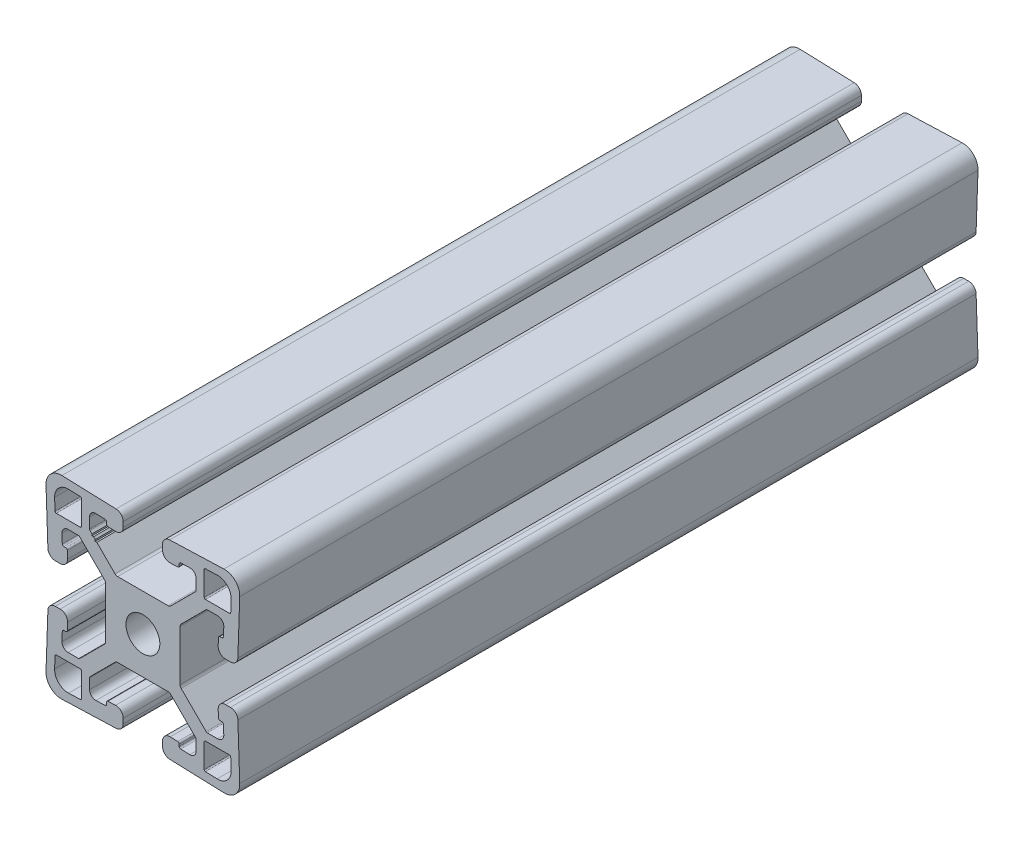
from build123d import *

# Parameters (mm, degrees)
BOSS_EXTRUDE1_DEPTH     = 76.2
CIRPATTERN1_COUNT       = 4
CUT_EXTRUDE1_DEPTH      = 82.280009843
CUT_EXTRUDE1_DEPTH_BACK = 82.280009843


with BuildPart() as part:
    # Sketch3 → Boss-Extrude1 (new, symmetric)
    with BuildSketch(Plane.XY):
        with BuildLine():
            Line((-7.681, 0), (-7.681, 5.210107796))
            ThreePointArc((-7.681, 5.210107796), (-7.739003796, 5.501712572), (-7.904184633, 5.748923164))
            Line((-7.904184633, 5.748923164), (-13.062267872, 10.907006403))
            ThreePointArc((-13.062267872, 10.907006403), (-13.165272285, 10.975831752), (-13.286774275, 11))
            Line((-13.286774275, 11), (-15.433540431, 11))
            ThreePointArc((-15.433540431, 11), (-16.347101978, 10.61221613), (-16.702766782, 9.685677639))
            Line((-16.702766782, 9.685677639), (-16.637141638, 7.80641941))
            ThreePointArc((-16.637141638, 7.80641941), (-16.540389083, 7.589109613), (-16.319835051, 7.5))
            Line((-16.319835051, 7.5), (-15.916428126, 7.5))
            ThreePointArc((-15.916428126, 7.5), (-15.695874093, 7.410890387), (-15.599121538, 7.19358059))
            Line((-15.599121538, 7.19358059), (-15.544946893, 5.642221732))
            ThreePointArc((-15.544946893, 5.642221732), (-15.972024709, 4.529645985), (-17.069017904, 4.064))
            Line((-17.069017904, 4.064), (-18.083635982, 4.064))
            ThreePointArc((-18.083635982, 4.064), (-19.142989997, 4.492006804), (-19.607706993, 5.535778268))
            Line((-19.607706993, 5.535778268), (-19.998065876, 16.714194098))
            ThreePointArc((-19.998065876, 16.714194098), (-19.07006403, 19.07006403), (-16.714194098, 19.998065876))
            Line((-16.714194098, 19.998065876), (-5.535778268, 19.607706993))
            ThreePointArc((-5.535778268, 19.607706993), (-4.492006804, 19.142989997), (-4.064, 18.083635982))
            Line((-4.064, 18.083635982), (-4.064, 17.069017904))
            ThreePointArc((-4.064, 17.069017904), (-4.529645985, 15.972024709), (-5.642221732, 15.544946893))
            Line((-5.642221732, 15.544946893), (-7.19358059, 15.599121538))
            ThreePointArc((-7.19358059, 15.599121538), (-7.410890387, 15.695874093), (-7.5, 15.916428126))
            Line((-7.5, 15.916428126), (-7.5, 16.319835051))
            ThreePointArc((-7.5, 16.319835051), (-7.589109613, 16.540389083), (-7.80641941, 16.637141638))
            Line((-7.80641941, 16.637141638), (-9.685677639, 16.702766782))
            ThreePointArc((-9.685677639, 16.702766782), (-10.61221613, 16.347101978), (-11, 15.433540431))
            Line((-11, 15.433540431), (-11, 13.286774275))
            ThreePointArc((-11, 13.286774275), (-10.975831752, 13.165272285), (-10.907006403, 13.062267872))
            Line((-10.907006403, 13.062267872), (-5.748923164, 7.904184633))
            ThreePointArc((-5.748923164, 7.904184633), (-5.501712572, 7.739003796), (-5.210107796, 7.681))
            Line((-5.210107796, 7.681), (0, 7.681))
            Line((0, 7.681), (0, 3.5))
            ThreePointArc((0, 3.5), (-2.474873734, 2.474873734), (-3.5, 0))
            Line((-3.5, 0), (-7.681, 0))
        make_face()
        with BuildLine():
            Line((-18.220706879, 15.330899714), (-18.136032248, 12.906135528))
            ThreePointArc((-18.136032248, 12.906135528), (-18.058630204, 12.732287691), (-17.882186978, 12.661))
            Line((-17.882186978, 12.661), (-12.915, 12.661))
            ThreePointArc((-12.915, 12.661), (-12.735394878, 12.735394878), (-12.661, 12.915))
            Line((-12.661, 12.915), (-12.661, 17.882186978))
            ThreePointArc((-12.661, 17.882186978), (-12.732287691, 18.058630204), (-12.906135528, 18.136032248))
            Line((-12.906135528, 18.136032248), (-15.330899714, 18.220706879))
            ThreePointArc((-15.330899714, 18.220706879), (-17.404065255, 17.404065255), (-18.220706879, 15.330899714))
        make_face(mode=Mode.SUBTRACT)
    boss_extrude1 = extrude(amount=BOSS_EXTRUDE1_DEPTH, both=True)

    # CirPattern1: Boss-Extrude1 ×4 about axis
    cirpattern1_axis = Axis((0, 0, 76.2), (0, 0, -1))
    for i in range(1, CIRPATTERN1_COUNT):
        add(boss_extrude1.rotate(cirpattern1_axis, i * 360 / CIRPATTERN1_COUNT))

    # Sketch4 → Cut-Extrude1 (cut, two sides: drawn at the far end of the back side and taken through both)
    with BuildSketch(Plane.XY.offset(-CUT_EXTRUDE1_DEPTH_BACK)):
        Polygon((-10.505738531, 12.661), (-9.505738531, 12.661), (-9.505738531, 11.661), (-9.839071864, 11.661), (-9.839071864, 11.994333333), (-10.172405198, 12.327666667), (-10.505738531, 12.327666667), align=None)
    extrude(amount=CUT_EXTRUDE1_DEPTH + CUT_EXTRUDE1_DEPTH_BACK, mode=Mode.SUBTRACT)


solid = part.part
